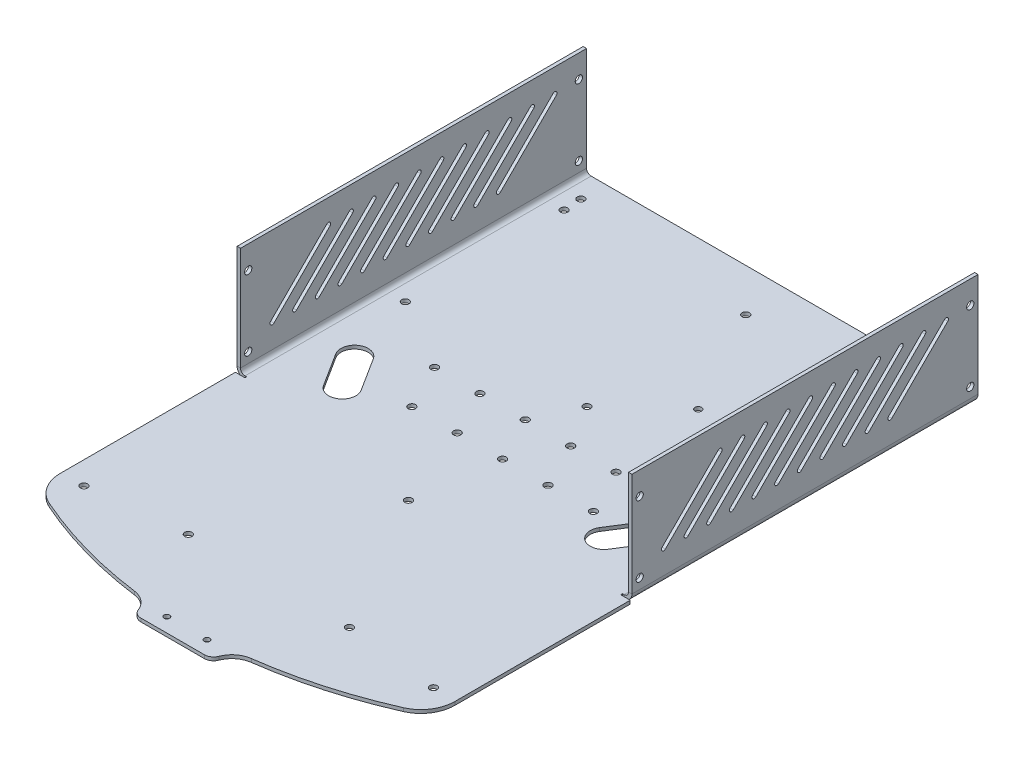
from build123d import *

# Parameters (mm, degrees)
SKETCH1_W                       = 174
SKETCH1_H                       = 240
BASE_FLANGE1_DEPTH              = 1.5
TAB1_DEPTH                      = 1.5
SKETCH5_R                       = 1.6
CUT_EXTRUDE1_DEPTH              = 166.449973767
FILLET2_R                       = 15
SKETCH6_R                       = 1.6
CUT_EXTRUDE2_DEPTH              = 166.449973767
EDGE_FLANGE2_STRIP_W            = 10
EDGE_FLANGE2_STRIP_H            = 1.5
EDGE_FLANGE2_STRIP_CUT_DEPTH    = 152.5
EDGE_FLANGE2_RELIEF_W           = 10.75
EDGE_FLANGE2_RELIEF_H           = 0.75
EDGE_FLANGE2_RELIEF_CUT_DEPTH   = 1.5
EDGE_FLANGE2_STRIP_2_W          = 10
EDGE_FLANGE2_STRIP_2_H          = 1.5
EDGE_FLANGE2_STRIP_CUT_2_DEPTH  = 152.5
EDGE_FLANGE2_RELIEF_2_W         = 10.75
EDGE_FLANGE2_RELIEF_2_H         = 0.75
EDGE_FLANGE2_RELIEF_CUT_2_DEPTH = 1.5
EDGE_FLANGE2_DEPTH              = 152.5
EDGE_FLANGE2_BEND_DEPTH         = 152.5
CUT_EXTRUDE5_DEPTH              = 229.809383154
TAB2_DEPTH                      = 1.5
FILLET3_R                       = 10
SKETCH39_R                      = 1.25
CUT_EXTRUDE6_DEPTH              = 179.080790966
CUT_EXTRUDE7_DEPTH              = 179.080790966
SKETCH41_R                      = 1.6
CUT_EXTRUDE8_DEPTH              = 234.280449521
F_3_0MM_DOWEL_HOLE1_D           = 3.2
F_3_0MM_DOWEL_HOLE1_DEPTH       = 5
F_3_0MM_DOWEL_HOLE3_D           = 2.9
F_3_0MM_DOWEL_HOLE3_DEPTH       = 5
SKETCH48_R                      = 1.6
CUT_EXTRUDE9_DEPTH              = 179.080790966


# Sheet-metal steps are written as plain solids
with BuildPart() as part:
    # Sketch1 → Base-Flange1 (new body)
    with BuildSketch(Plane(origin=(0, 0, 0), x_dir=(1, 0, 0), z_dir=(0, 1, 0))):
        Rectangle(SKETCH1_W, SKETCH1_H)
    extrude(amount=-BASE_FLANGE1_DEPTH)

    # Sketch2 → Tab1 (add)
    with BuildSketch(Plane(origin=(0, 0, 0), x_dir=(1, 0, 0), z_dir=(0, 1, 0))):
        with BuildLine():
            Line((87, -120), (-87, -120))
            ThreePointArc((-87, -120), (0, -140.721156261), (87, -120))
        make_face()
    extrude(amount=-TAB1_DEPTH)

    # Sketch5 → Cut-Extrude1 (cut, through all)
    with BuildSketch(Plane(origin=(0, 0, 0), x_dir=(1, 0, 0), z_dir=(0, 1, 0))):
        with Locations(Location((77, -110, 0), (0, 0, 270))):
            Circle(SKETCH5_R)
        with Locations(Location((-77, -110, 0), (0, 0, 90))):
            Circle(SKETCH5_R)
        with Locations(Location((-77, 109, 0), (0, 0, 270))):
            Circle(SKETCH5_R)
        with Locations(Location((77, 109, 0), (0, 0, 270))):
            Circle(SKETCH5_R)
    extrude(amount=-CUT_EXTRUDE1_DEPTH, mode=Mode.SUBTRACT)

    # Fillet2
    fillet2_edges = [part.edges().sort_by_distance(p)[0] for p in [
        (87, -0.75, 120),
        (-87, -0.75, 120),
    ]]
    fillet(fillet2_edges, radius=FILLET2_R)

    # Sketch6 → Cut-Extrude2 (cut, through all)
    with BuildSketch(Plane(origin=(0, 0, 0), x_dir=(1, 0, 0), z_dir=(0, 1, 0))):
        with Locations(Location((0, -44, 0), (0, 0, 270))):
            Circle(SKETCH6_R)
        with Locations(Location((35.507041555, -105.5, 0), (0, 0, 270))):
            Circle(SKETCH6_R)
        with Locations(Location((-35.507041555, -105.5, 0), (0, 0, 270))):
            Circle(SKETCH6_R)
    extrude(amount=-CUT_EXTRUDE2_DEPTH, mode=Mode.SUBTRACT)

    # Edge-Flange2 strip (across the edge) → Edge-Flange2 strip cut (cut)
    with BuildSketch(Plane(origin=(87, 0, 32.5), x_dir=(-1, 0, 0), z_dir=(0, 0, -1))):
        with Locations((-1.5, -0.75)):
            Rectangle(EDGE_FLANGE2_STRIP_W, EDGE_FLANGE2_STRIP_H)
    extrude(amount=EDGE_FLANGE2_STRIP_CUT_DEPTH, mode=Mode.SUBTRACT)

    # Edge-Flange2 relief (on the sheet) → Edge-Flange2 relief cut (cut)
    with BuildSketch(Plane(origin=(83.5, 0, 32.5), x_dir=(-1, 0, 0), z_dir=(0, 1, 0))):
        with Locations((-4.625, 0.375)):
            Rectangle(EDGE_FLANGE2_RELIEF_W, EDGE_FLANGE2_RELIEF_H)
    extrude(amount=-EDGE_FLANGE2_RELIEF_CUT_DEPTH, mode=Mode.SUBTRACT)

    # Edge-Flange2 strip 2 (across the edge) → Edge-Flange2 strip cut 2 (cut)
    with BuildSketch(Plane(origin=(-87, 0, -120), x_dir=(1, 0, 0), z_dir=(0, 0, 1))):
        with Locations((-1.5, -0.75)):
            Rectangle(EDGE_FLANGE2_STRIP_2_W, EDGE_FLANGE2_STRIP_2_H)
    extrude(amount=EDGE_FLANGE2_STRIP_CUT_2_DEPTH, mode=Mode.SUBTRACT)

    # Edge-Flange2 relief 2 (on the sheet) → Edge-Flange2 relief cut 2 (cut)
    with BuildSketch(Plane(origin=(-83.5, 0, -120), x_dir=(1, 0, 0), z_dir=(0, 1, 0))):
        with Locations((-4.625, -152.875)):
            Rectangle(EDGE_FLANGE2_RELIEF_2_W, EDGE_FLANGE2_RELIEF_2_H)
    extrude(amount=-EDGE_FLANGE2_RELIEF_CUT_2_DEPTH, mode=Mode.SUBTRACT)

    # Edge-Flange2 section (across the edge) → Edge-Flange2 (add)
    with BuildSketch(Plane(origin=(87, 0, 32.5), x_dir=(-1, 0, 0), z_dir=(0, 0, -1))):
        with BuildLine():
            Line((0, 2), (0, 47.7))
            Line((0, 47.7), (1.5, 47.7))
            Line((1.5, 47.7), (1.5, 2))
            ThreePointArc((1.5, 2), (2.085786438, 0.585786438), (3.5, 0))
            Line((3.5, 0), (3.5, -1.5))
            ThreePointArc((3.5, -1.5), (1.025126266, -0.474873734), (0, 2))
        make_face()
    extrude(amount=EDGE_FLANGE2_DEPTH)

    # Edge-Flange2 section 2 (across the edge) → Edge-Flange2 bend (add)
    with BuildSketch(Plane(origin=(-87, 0, -120), x_dir=(1, 0, 0), z_dir=(0, 0, 1))):
        with BuildLine():
            Line((0, 2), (0, 47.7))
            Line((0, 47.7), (1.5, 47.7))
            Line((1.5, 47.7), (1.5, 2))
            ThreePointArc((1.5, 2), (2.085786438, 0.585786438), (3.5, 0))
            Line((3.5, 0), (3.5, -1.5))
            ThreePointArc((3.5, -1.5), (1.025126266, -0.474873734), (0, 2))
        make_face()
    extrude(amount=EDGE_FLANGE2_BEND_DEPTH)

    # Sketch37 → Cut-Extrude5 (cut, through all)
    with BuildSketch(Plane(origin=(87, 0, 0), x_dir=(0, 0, -1), z_dir=(1, 0, 0))):
        with BuildLine():
            Line((-17.792893219, 11.768524548), (6.955844123, 36.51726189))
            ThreePointArc((6.955844123, 36.51726189), (6.955844123, 37.931475452), (5.54163056, 37.931475452))
            Line((5.54163056, 37.931475452), (-19.207106781, 13.18273811))
            ThreePointArc((-19.207106781, 13.18273811), (-19.207106781, 11.768524548), (-17.792893219, 11.768524548))
        make_face()
        with BuildLine():
            Line((-7.817766953, 11.768524548), (16.930970389, 36.51726189))
            ThreePointArc((16.930970389, 36.51726189), (16.930970389, 37.931475452), (15.516756826, 37.931475452))
            Line((15.516756826, 37.931475452), (-9.231980515, 13.18273811))
            ThreePointArc((-9.231980515, 13.18273811), (-9.231980515, 11.768524548), (-7.817766953, 11.768524548))
        make_face()
        with BuildLine():
            Line((2.157359313, 11.768524548), (26.906096654, 36.51726189))
            ThreePointArc((26.906096654, 36.51726189), (26.906096654, 37.931475452), (25.491883092, 37.931475452))
            Line((25.491883092, 37.931475452), (0.743145751, 13.18273811))
            ThreePointArc((0.743145751, 13.18273811), (0.743145751, 11.768524548), (2.157359313, 11.768524548))
        make_face()
        with BuildLine():
            Line((12.132485579, 11.768524548), (36.88122292, 36.51726189))
            ThreePointArc((36.88122292, 36.51726189), (36.88122292, 37.931475452), (35.467009358, 37.931475452))
            Line((35.467009358, 37.931475452), (10.718272016, 13.18273811))
            ThreePointArc((10.718272016, 13.18273811), (10.718272016, 11.768524548), (12.132485579, 11.768524548))
        make_face()
        with BuildLine():
            Line((22.107611845, 11.768524548), (46.856349186, 36.51726189))
            ThreePointArc((46.856349186, 36.51726189), (46.856349186, 37.931475452), (45.442135624, 37.931475452))
            Line((45.442135624, 37.931475452), (20.693398282, 13.18273811))
            ThreePointArc((20.693398282, 13.18273811), (20.693398282, 11.768524548), (22.107611845, 11.768524548))
        make_face()
        with BuildLine():
            Line((32.08273811, 11.768524548), (56.831475452, 36.51726189))
            ThreePointArc((56.831475452, 36.51726189), (56.831475452, 37.931475452), (55.41726189, 37.931475452))
            Line((55.41726189, 37.931475452), (30.668524548, 13.18273811))
            ThreePointArc((30.668524548, 13.18273811), (30.668524548, 11.768524548), (32.08273811, 11.768524548))
        make_face()
        with BuildLine():
            Line((42.057864376, 11.768524548), (66.806601718, 36.51726189))
            ThreePointArc((66.806601718, 36.51726189), (66.806601718, 37.931475452), (65.392388155, 37.931475452))
            Line((65.392388155, 37.931475452), (40.643650814, 13.18273811))
            ThreePointArc((40.643650814, 13.18273811), (40.643650814, 11.768524548), (42.057864376, 11.768524548))
        make_face()
        with BuildLine():
            Line((52.032990642, 11.768524548), (76.781727984, 36.51726189))
            ThreePointArc((76.781727984, 36.51726189), (76.781727984, 37.931475452), (75.367514421, 37.931475452))
            Line((75.367514421, 37.931475452), (50.61877708, 13.18273811))
            ThreePointArc((50.61877708, 13.18273811), (50.61877708, 11.768524548), (52.032990642, 11.768524548))
        make_face()
        with BuildLine():
            Line((62.008116908, 11.768524548), (86.756854249, 36.51726189))
            ThreePointArc((86.756854249, 36.51726189), (86.756854249, 37.931475452), (85.342640687, 37.931475452))
            Line((85.342640687, 37.931475452), (60.593903346, 13.18273811))
            ThreePointArc((60.593903346, 13.18273811), (60.593903346, 11.768524548), (62.008116908, 11.768524548))
        make_face()
        with BuildLine():
            Line((71.983243174, 11.768524548), (96.731980515, 36.51726189))
            ThreePointArc((96.731980515, 36.51726189), (96.731980515, 37.931475452), (95.317766953, 37.931475452))
            Line((95.317766953, 37.931475452), (70.569029611, 13.18273811))
            ThreePointArc((70.569029611, 13.18273811), (70.569029611, 11.768524548), (71.983243174, 11.768524548))
        make_face()
        with BuildLine():
            Line((81.95836944, 11.768524548), (106.707106781, 36.51726189))
            ThreePointArc((106.707106781, 36.51726189), (106.707106781, 37.931475452), (105.292893219, 37.931475452))
            Line((105.292893219, 37.931475452), (80.544155877, 13.18273811))
            ThreePointArc((80.544155877, 13.18273811), (80.544155877, 11.768524548), (81.95836944, 11.768524548))
        make_face()
    extrude(amount=-CUT_EXTRUDE5_DEPTH, mode=Mode.SUBTRACT)

    # Sketch38 → Tab2 (add)
    with BuildSketch(Plane(origin=(0, 0, 0), x_dir=(1, 0, 0), z_dir=(0, 1, 0))):
        with BuildLine():
            Line((-18, -139.879944767), (-18, -143.879944767))
            ThreePointArc((-18, -143.879944767), (-16.828427125, -146.708371892), (-14, -147.879944767))
            Line((-14, -147.879944767), (14, -147.879944767))
            ThreePointArc((14, -147.879944767), (16.828427125, -146.708371892), (18, -143.879944767))
            Line((18, -143.879944767), (18, -139.879944767))
            ThreePointArc((18, -139.879944767), (0, -140.721156261), (-18, -139.879944767))
        make_face()
    extrude(amount=-TAB2_DEPTH)

    # Fillet3
    fillet3_edges = [part.edges().sort_by_distance(p)[0] for p in [
        (-18, -0.75, 139.879944767),
        (18, -0.75, 139.879944767),
    ]]
    fillet(fillet3_edges, radius=FILLET3_R)

    # Sketch39 → Cut-Extrude6 (cut, through all)
    with BuildSketch(Plane(origin=(0, 0, 0), x_dir=(1, 0, 0), z_dir=(0, 1, 0))):
        with Locations(Location((-8.835, -141.629944767, 0), (0, 0, 270))):
            Circle(SKETCH39_R)
        with Locations(Location((8.835, -141.629944767, 0), (0, 0, 90))):
            Circle(SKETCH39_R)
    extrude(amount=-CUT_EXTRUDE6_DEPTH, mode=Mode.SUBTRACT)

    # Sketch40 → Cut-Extrude7 (cut, through all)
    with BuildSketch(Plane(origin=(0, 0, 0), x_dir=(1, 0, 0), z_dir=(0, 1, 0))):
        with BuildLine():
            Line((-52.401456208, -12.452025481), (-61.778425121, 2.323713215))
            ThreePointArc((-61.778425121, 2.323713215), (-70.059353444, 4.174719998), (-71.910360227, -4.106208325))
            Line((-71.910360227, -4.106208325), (-62.533391315, -18.881947021))
            ThreePointArc((-62.533391315, -18.881947021), (-54.252462992, -20.732953804), (-52.401456208, -12.452025481))
        make_face()
        with BuildLine():
            Line((62.667348013, -18.67086504), (77.134671478, 4.125988949))
            ThreePointArc((77.134671478, 4.125988949), (75.283664695, 12.406917272), (67.002736372, 10.555910489))
            Line((67.002736372, 10.555910489), (52.535412907, -12.2409435))
            ThreePointArc((52.535412907, -12.2409435), (54.38641969, -20.521871823), (62.667348013, -18.67086504))
        make_face()
    extrude(amount=-CUT_EXTRUDE7_DEPTH, mode=Mode.SUBTRACT)

    # Sketch41 → Cut-Extrude8 (cut, through all)
    with BuildSketch(Plane(origin=(87, 0, 0), x_dir=(0, 0, -1), z_dir=(1, 0, 0))):
        with Locations(Location((116.6, 6.5, 0), (0, 0, 90))):
            Circle(SKETCH41_R)
        with Locations(Location((116.6, 37.6, 0), (0, 0, 90))):
            Circle(SKETCH41_R)
        with Locations(Location((-29.1, 6.5, 0), (0, 0, 90))):
            Circle(SKETCH41_R)
        with Locations(Location((-29.1, 37.6, 0), (0, 0, 90))):
            Circle(SKETCH41_R)
    extrude(amount=-CUT_EXTRUDE8_DEPTH, mode=Mode.SUBTRACT)

    # Ø3.0mm Dowel Hole1
    with Locations(Plane(origin=(0, -1.5, 0), x_dir=(-1, 0, 0), z_dir=(0, -1, 0))):
        with Locations((-3.542967946, 31.128115012), (-3.509610211, 101.128107064), (76.45702297, 31.089991885), (76.490380706, 101.089983937)):
            Hole(F_3_0MM_DOWEL_HOLE1_D / 2, depth=F_3_0MM_DOWEL_HOLE1_DEPTH)

    # Ø3.0mm Dowel Hole3
    with Locations(Plane(origin=(0, -1.5, 0), x_dir=(-1, 0, 0), z_dir=(0, -1, 0))):
        with Locations((-29.100019, 54.600021), (-78.099997, 54.600021)):
            Hole(F_3_0MM_DOWEL_HOLE3_D / 2, depth=F_3_0MM_DOWEL_HOLE3_DEPTH)

    # Sketch48 → Cut-Extrude9 (cut, through all)
    with BuildSketch(Plane(origin=(0, 0, 0), x_dir=(1, 0, 0), z_dir=(0, 1, 0))):
        with Locations(Location((-45, 12.5, 0), (0, 0, 270))):
            Circle(SKETCH48_R)
        with Locations(Location((-35, -7.5, 0), (0, 0, 270))):
            Circle(SKETCH48_R)
        with Locations(Location((-25, 12.5, 0), (0, 0, 270))):
            Circle(SKETCH48_R)
        with Locations(Location((-15, -7.5, 0), (0, 0, 270))):
            Circle(SKETCH48_R)
        with Locations(Location((-5, 12.5, 0), (0, 0, 270))):
            Circle(SKETCH48_R)
        with Locations(Location((5, -7.5, 0), (0, 0, 270))):
            Circle(SKETCH48_R)
        with Locations(Location((15, 12.5, 0), (0, 0, 270))):
            Circle(SKETCH48_R)
        with Locations(Location((25, -7.5, 0), (0, 0, 270))):
            Circle(SKETCH48_R)
        with Locations(Location((35, 12.5, 0), (0, 0, 270))):
            Circle(SKETCH48_R)
        with Locations(Location((45, -7.5, 0), (0, 0, 270))):
            Circle(SKETCH48_R)
    extrude(amount=-CUT_EXTRUDE9_DEPTH, mode=Mode.SUBTRACT)


solid = part.part
